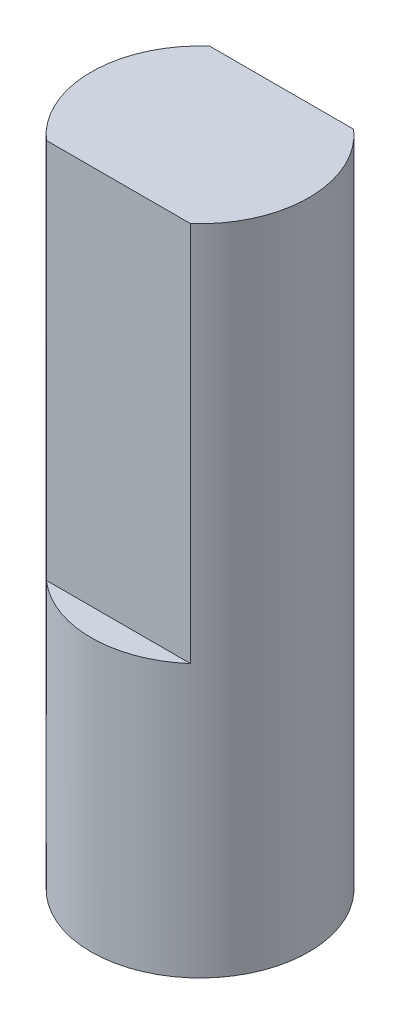
from build123d import *

# Parameters (mm, degrees)
CROQUIS1_R              = 4
SALIENTE_EXTRUIR1_DEPTH = 10
SALIENTE_EXTRUIR2_DEPTH = 14


with BuildPart() as part:
    # Croquis1 → Saliente-Extruir1 (new body)
    with BuildSketch(Plane(origin=(0, 0, 0), x_dir=(1, 0, 0), z_dir=(0, 1, 0))):
        Circle(CROQUIS1_R)
    extrude(amount=SALIENTE_EXTRUIR1_DEPTH)

    # Croquis2 → Saliente-Extruir2 (add)
    with BuildSketch(Plane(origin=(0, 10, 0), x_dir=(1, 0, 0), z_dir=(0, 1, 0))):
        with BuildLine():
            Line((-2.645751311, -3), (2.645751311, -3))
            ThreePointArc((2.645751311, -3), (4, 0), (2.645751311, 3))
            Line((2.645751311, 3), (-2.645751311, 3))
            ThreePointArc((-2.645751311, 3), (-4, 0), (-2.645751311, -3))
        make_face()
    extrude(amount=SALIENTE_EXTRUIR2_DEPTH)


solid = part.part
